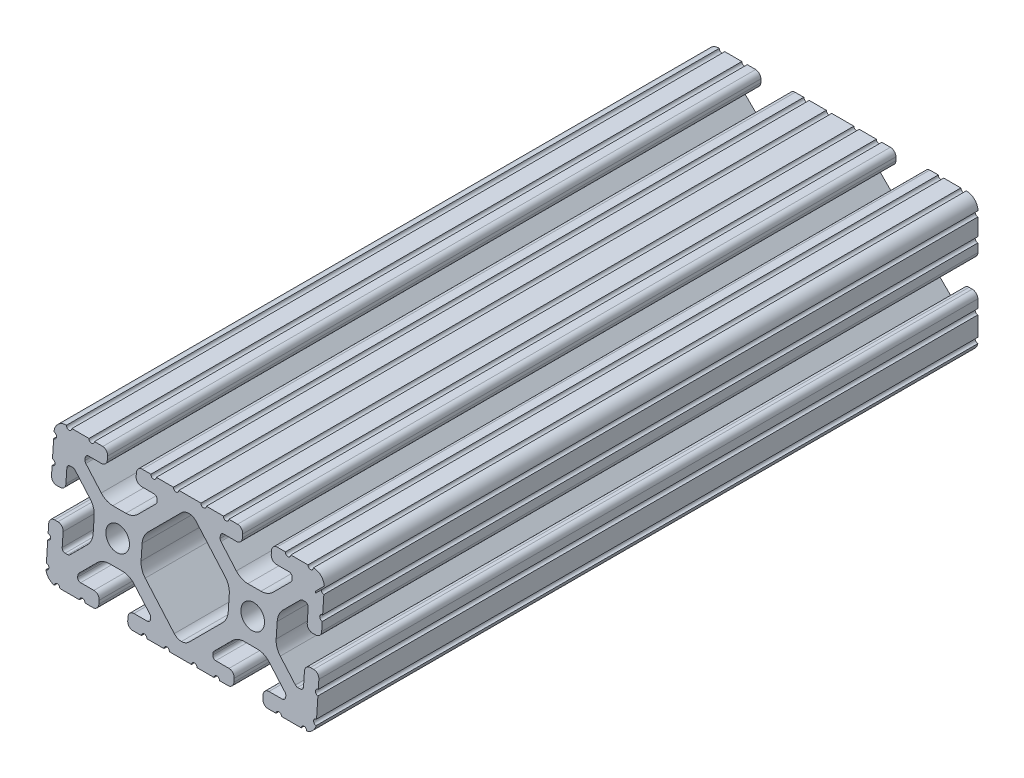
from build123d import *

# Parameters (mm, degrees)
SKETCH1_R          = 3.3274
EXTRUDE1_DEPTH     = 186.817
CUT_EXTRUDE1_DEPTH = 127


with BuildPart() as part:
    # Sketch1 → Extrude1 (new body)
    with BuildSketch(Plane.XY):
        with BuildLine():
            Line((-3.121121376, -19.05), (3.121121376, -19.05))
            ThreePointArc((3.121121376, -19.05), (3.883121376, -18.288), (4.645121376, -19.05))
            Line((4.645121376, -19.05), (8.633115796, -19.05))
            Line((8.633115796, -19.05), (9.473536067, -19.05))
            ThreePointArc((9.473536067, -19.05), (10.235536067, -18.288), (10.997536067, -19.05))
            Line((10.997536067, -19.05), (13.4112, -19.05))
            ThreePointArc((13.4112, -19.05), (14.524751759, -18.588751759), (14.986, -17.4752))
            Line((14.986, -17.4752), (14.986, -16.5608))
            ThreePointArc((14.986, -16.5608), (14.524751759, -15.447248241), (13.4112, -14.986))
            Line((13.4112, -14.986), (9.652, -14.986))
            ThreePointArc((9.652, -14.986), (9.023382072, -14.725617928), (8.763, -14.097))
            Line((8.763, -14.097), (8.763, -13.687179678))
            ThreePointArc((8.763, -13.687179678), (8.830670671, -13.346975131), (9.023380503, -13.058563318))
            Line((9.023380503, -13.058563318), (13.852498595, -8.229421131))
            ThreePointArc((13.852498595, -8.229421131), (15.393447522, -7.199787805), (17.211122763, -6.838228541))
            Line((17.211122763, -6.838228541), (20.888877237, -6.838228541))
            ThreePointArc((20.888877237, -6.838228541), (22.706552478, -7.199787805), (24.247501405, -8.229421131))
            Line((24.247501405, -8.229421131), (29.076619497, -13.058563318))
            ThreePointArc((29.076619497, -13.058563318), (29.269329329, -13.346975131), (29.337, -13.687179678))
            Line((29.337, -13.687179678), (29.337, -14.097))
            ThreePointArc((29.337, -14.097), (29.076617928, -14.725617928), (28.448, -14.986))
            Line((28.448, -14.986), (24.6888, -14.986))
            ThreePointArc((24.6888, -14.986), (23.575248241, -15.447248241), (23.114, -16.5608))
            Line((23.114, -16.5608), (23.114, -17.4752))
            ThreePointArc((23.114, -17.4752), (23.575248241, -18.588751759), (24.6888, -19.05))
            Line((24.6888, -19.05), (26.945817469, -19.05))
            ThreePointArc((26.945817469, -19.05), (27.707817469, -18.288), (28.469817469, -19.05))
            Line((28.469817469, -19.05), (29.207115796, -19.05))
            Line((29.207115796, -19.05), (34.047273398, -19.05))
            ThreePointArc((34.047273398, -19.05), (34.809273398, -18.288), (35.571273398, -19.05))
            ThreePointArc((35.571273398, -19.05), (37.207577603, -18.182738167), (38.1, -16.560019212))
            ThreePointArc((38.1, -16.560019212), (37.338, -15.798019212), (38.1, -15.036019212))
            Line((38.1, -15.036019212), (38.1, -10.287))
            Line((38.1, -10.287), (38.1, -9.549701672))
            ThreePointArc((38.1, -9.549701672), (37.338, -8.787701672), (38.1, -8.025701672))
            Line((38.1, -8.025701672), (38.1, -5.6388))
            ThreePointArc((38.1, -5.6388), (37.638751759, -4.525248241), (36.5252, -4.064))
            Line((36.5252, -4.064), (35.6108, -4.064))
            ThreePointArc((35.6108, -4.064), (34.497248241, -4.525248241), (34.036, -5.6388))
            Line((34.036, -5.6388), (34.036, -9.398))
            ThreePointArc((34.036, -9.398), (33.775617928, -10.026617928), (33.147, -10.287))
            Line((33.147, -10.287), (32.420656743, -10.287))
            ThreePointArc((32.420656743, -10.287), (32.080450147, -10.21932848), (31.792037247, -10.02661636))
            Line((31.792037247, -10.02661636), (27.197575832, -5.43213202))
            ThreePointArc((27.197575832, -5.43213202), (26.167954729, -3.891188903), (25.8064, -2.07352461))
            Line((25.8064, -2.07352461), (25.8064, 2.07352461))
            ThreePointArc((25.8064, 2.07352461), (26.167954729, 3.891188903), (27.197575832, 5.43213202))
            Line((27.197575832, 5.43213202), (31.792037247, 10.02661636))
            ThreePointArc((31.792037247, 10.02661636), (32.080450147, 10.21932848), (32.420656743, 10.287))
            Line((32.420656743, 10.287), (33.147, 10.287))
            ThreePointArc((33.147, 10.287), (33.775617928, 10.026617928), (34.036, 9.398))
            Line((34.036, 9.398), (34.036, 5.6388))
            ThreePointArc((34.036, 5.6388), (34.497248241, 4.525248241), (35.6108, 4.064))
            Line((35.6108, 4.064), (36.5252, 4.064))
            ThreePointArc((36.5252, 4.064), (37.638751759, 4.525248241), (38.1, 5.6388))
            Line((38.1, 5.6388), (38.1, 8.025701672))
            ThreePointArc((38.1, 8.025701672), (37.338, 8.787701672), (38.1, 9.549701672))
            Line((38.1, 9.549701672), (38.1, 10.287))
            Line((38.1, 10.287), (38.1, 14.375206214))
            ThreePointArc((38.1, 14.375206214), (37.338232276, 15.156019383), (38.137614868, 15.89827725))
            ThreePointArc((38.137614868, 15.89827725), (37.148019028, 18.192014021), (34.819536496, 19.096833012))
            ThreePointArc((34.819536496, 19.096833012), (34.081312886, 18.311776389), (33.296256263, 19.05))
            Line((33.296256263, 19.05), (29.207115796, 19.05))
            Line((29.207115796, 19.05), (28.469817468, 19.05))
            ThreePointArc((28.469817468, 19.05), (27.707817468, 18.288), (26.945817468, 19.05))
            Line((26.945817468, 19.05), (24.558915796, 19.05))
            ThreePointArc((24.558915796, 19.05), (23.53023695, 18.547208069), (23.114, 17.480565346))
            Line((23.114, 17.480565346), (23.114, 16.5608))
            ThreePointArc((23.114, 16.5608), (23.575248241, 15.447248241), (24.6888, 14.986))
            Line((24.6888, 14.986), (28.295243665, 14.986))
            ThreePointArc((28.295243665, 14.986), (28.923861593, 14.725617928), (29.184243665, 14.097))
            Line((29.184243665, 14.097), (29.184243665, 13.53442258))
            ThreePointArc((29.184243665, 13.53442258), (29.116572993, 13.194218033), (28.923863161, 12.90580622))
            Line((28.923863161, 12.90580622), (24.247501405, 8.229421131))
            ThreePointArc((24.247501405, 8.229421131), (22.706552478, 7.199787805), (20.888877237, 6.838228541))
            Line((20.888877237, 6.838228541), (17.211122763, 6.838228541))
            ThreePointArc((17.211122763, 6.838228541), (15.393447522, 7.199787805), (13.852498595, 8.229421131))
            Line((13.852498595, 8.229421131), (9.176136839, 12.90580622))
            ThreePointArc((9.176136839, 12.90580622), (8.983427007, 13.194218033), (8.915756335, 13.53442258))
            Line((8.915756335, 13.53442258), (8.915756335, 14.097))
            ThreePointArc((8.915756335, 14.097), (9.176138407, 14.725617928), (9.804756335, 14.986))
            Line((9.804756335, 14.986), (13.4112, 14.986))
            ThreePointArc((13.4112, 14.986), (14.524751759, 15.447248241), (14.986, 16.5608))
            Line((14.986, 16.5608), (14.986, 17.496772581))
            ThreePointArc((14.986, 17.496772581), (14.531070222, 18.595070222), (13.432772581, 19.05))
            Line((13.432772581, 19.05), (10.997536067, 19.05))
            ThreePointArc((10.997536067, 19.05), (10.235536067, 18.288), (9.473536067, 19.05))
            Line((9.473536067, 19.05), (8.633115796, 19.05))
            Line((8.633115796, 19.05), (4.645121376, 19.05))
            ThreePointArc((4.645121376, 19.05), (3.883121376, 18.288), (3.121121376, 19.05))
            Line((3.121121376, 19.05), (-3.121121376, 19.05))
            ThreePointArc((-3.121121376, 19.05), (-3.883121376, 18.288), (-4.645121376, 19.05))
            Line((-4.645121376, 19.05), (-8.633115796, 19.05))
            Line((-8.633115796, 19.05), (-9.473536067, 19.05))
            ThreePointArc((-9.473536067, 19.05), (-10.235536067, 18.288), (-10.997536067, 19.05))
            Line((-10.997536067, 19.05), (-13.432772581, 19.05))
            ThreePointArc((-13.432772581, 19.05), (-14.531070222, 18.595070222), (-14.986, 17.496772581))
            Line((-14.986, 17.496772581), (-14.986, 16.5608))
            ThreePointArc((-14.986, 16.5608), (-14.524751759, 15.447248241), (-13.4112, 14.986))
            Line((-13.4112, 14.986), (-9.804756335, 14.986))
            ThreePointArc((-9.804756335, 14.986), (-9.176138407, 14.725617928), (-8.915756335, 14.097))
            Line((-8.915756335, 14.097), (-8.915756335, 13.53442258))
            ThreePointArc((-8.915756335, 13.53442258), (-8.983427007, 13.194218033), (-9.176136839, 12.90580622))
            Line((-9.176136839, 12.90580622), (-13.852498595, 8.229421131))
            ThreePointArc((-13.852498595, 8.229421131), (-15.393447522, 7.199787805), (-17.211122763, 6.838228541))
            Line((-17.211122763, 6.838228541), (-20.888877237, 6.838228541))
            ThreePointArc((-20.888877237, 6.838228541), (-22.706552478, 7.199787805), (-24.247501405, 8.229421131))
            Line((-24.247501405, 8.229421131), (-28.923863161, 12.90580622))
            ThreePointArc((-28.923863161, 12.90580622), (-29.116572993, 13.194218033), (-29.184243665, 13.53442258))
            Line((-29.184243665, 13.53442258), (-29.184243665, 14.097))
            ThreePointArc((-29.184243665, 14.097), (-28.923861593, 14.725617928), (-28.295243665, 14.986))
            Line((-28.295243665, 14.986), (-24.6888, 14.986))
            ThreePointArc((-24.6888, 14.986), (-23.575248241, 15.447248241), (-23.114, 16.5608))
            Line((-23.114, 16.5608), (-23.114, 17.480565346))
            ThreePointArc((-23.114, 17.480565346), (-23.53023695, 18.547208069), (-24.558915796, 19.05))
            Line((-24.558915796, 19.05), (-26.945817468, 19.05))
            ThreePointArc((-26.945817468, 19.05), (-27.707817468, 18.288), (-28.469817468, 19.05))
            Line((-28.469817468, 19.05), (-29.207115796, 19.05))
            Line((-29.207115796, 19.05), (-33.296256263, 19.05))
            ThreePointArc((-33.296256263, 19.05), (-34.081312886, 18.311776389), (-34.819536496, 19.096833012))
            ThreePointArc((-34.819536496, 19.096833012), (-37.148019028, 18.192014021), (-38.137614868, 15.89827725))
            ThreePointArc((-38.137614868, 15.89827725), (-37.338232276, 15.156019383), (-38.1, 14.375206214))
            Line((-38.1, 14.375206214), (-38.1, 10.287))
            Line((-38.1, 10.287), (-38.1, 9.549701672))
            ThreePointArc((-38.1, 9.549701672), (-37.338, 8.787701672), (-38.1, 8.025701672))
            Line((-38.1, 8.025701672), (-38.1, 5.6388))
            ThreePointArc((-38.1, 5.6388), (-37.638751759, 4.525248241), (-36.5252, 4.064))
            Line((-36.5252, 4.064), (-35.6108, 4.064))
            ThreePointArc((-35.6108, 4.064), (-34.497248241, 4.525248241), (-34.036, 5.6388))
            Line((-34.036, 5.6388), (-34.036, 9.398))
            ThreePointArc((-34.036, 9.398), (-33.775617928, 10.026617928), (-33.147, 10.287))
            Line((-33.147, 10.287), (-32.420656743, 10.287))
            ThreePointArc((-32.420656743, 10.287), (-32.080450147, 10.21932848), (-31.792037247, 10.02661636))
            Line((-31.792037247, 10.02661636), (-27.197575832, 5.43213202))
            ThreePointArc((-27.197575832, 5.43213202), (-26.167954729, 3.891188903), (-25.8064, 2.07352461))
            Line((-25.8064, 2.07352461), (-25.8064, -2.07352461))
            ThreePointArc((-25.8064, -2.07352461), (-26.167954729, -3.891188903), (-27.197575832, -5.43213202))
            Line((-27.197575832, -5.43213202), (-31.792037247, -10.02661636))
            ThreePointArc((-31.792037247, -10.02661636), (-32.080450147, -10.21932848), (-32.420656743, -10.287))
            Line((-32.420656743, -10.287), (-33.147, -10.287))
            ThreePointArc((-33.147, -10.287), (-33.775617928, -10.026617928), (-34.036, -9.398))
            Line((-34.036, -9.398), (-34.036, -5.6388))
            ThreePointArc((-34.036, -5.6388), (-34.497248241, -4.525248241), (-35.6108, -4.064))
            Line((-35.6108, -4.064), (-36.5252, -4.064))
            ThreePointArc((-36.5252, -4.064), (-37.638751759, -4.525248241), (-38.1, -5.6388))
            Line((-38.1, -5.6388), (-38.1, -8.025701672))
            ThreePointArc((-38.1, -8.025701672), (-37.338, -8.787701672), (-38.1, -9.549701672))
            Line((-38.1, -9.549701672), (-38.1, -10.287))
            Line((-38.1, -10.287), (-38.1, -15.036019212))
            ThreePointArc((-38.1, -15.036019212), (-37.338, -15.798019212), (-38.1, -16.560019212))
            ThreePointArc((-38.1, -16.560019212), (-37.20882252, -18.184002456), (-35.571273398, -19.05))
            ThreePointArc((-35.571273398, -19.05), (-34.809273398, -18.288), (-34.047273398, -19.05))
            Line((-34.047273398, -19.05), (-29.207115796, -19.05))
            Line((-29.207115796, -19.05), (-28.469817469, -19.05))
            ThreePointArc((-28.469817469, -19.05), (-27.707817469, -18.288), (-26.945817469, -19.05))
            Line((-26.945817469, -19.05), (-24.6888, -19.05))
            ThreePointArc((-24.6888, -19.05), (-23.575248241, -18.588751759), (-23.114, -17.4752))
            Line((-23.114, -17.4752), (-23.114, -16.5608))
            ThreePointArc((-23.114, -16.5608), (-23.575248241, -15.447248241), (-24.6888, -14.986))
            Line((-24.6888, -14.986), (-28.448, -14.986))
            ThreePointArc((-28.448, -14.986), (-29.076617928, -14.725617928), (-29.337, -14.097))
            Line((-29.337, -14.097), (-29.337, -13.687179678))
            ThreePointArc((-29.337, -13.687179678), (-29.269329329, -13.346975131), (-29.076619497, -13.058563318))
            Line((-29.076619497, -13.058563318), (-24.247501405, -8.229421131))
            ThreePointArc((-24.247501405, -8.229421131), (-22.706552478, -7.199787805), (-20.888877237, -6.838228541))
            Line((-20.888877237, -6.838228541), (-17.211122763, -6.838228541))
            ThreePointArc((-17.211122763, -6.838228541), (-15.393447522, -7.199787805), (-13.852498595, -8.229421131))
            Line((-13.852498595, -8.229421131), (-9.023380503, -13.058563318))
            ThreePointArc((-9.023380503, -13.058563318), (-8.830670671, -13.346975131), (-8.763, -13.687179678))
            Line((-8.763, -13.687179678), (-8.763, -14.097))
            ThreePointArc((-8.763, -14.097), (-9.023382072, -14.725617928), (-9.652, -14.986))
            Line((-9.652, -14.986), (-13.4112, -14.986))
            ThreePointArc((-13.4112, -14.986), (-14.524751759, -15.447248241), (-14.986, -16.5608))
            Line((-14.986, -16.5608), (-14.986, -17.4752))
            ThreePointArc((-14.986, -17.4752), (-14.524751759, -18.588751759), (-13.4112, -19.05))
            Line((-13.4112, -19.05), (-10.997536067, -19.05))
            ThreePointArc((-10.997536067, -19.05), (-10.235536067, -18.288), (-9.473536067, -19.05))
            Line((-9.473536067, -19.05), (-8.633115796, -19.05))
            Line((-8.633115796, -19.05), (-4.645121376, -19.05))
            ThreePointArc((-4.645121376, -19.05), (-3.883121376, -18.288), (-3.121121376, -19.05))
        make_face()
        with Locations((19.05, 0)):
            Circle(SKETCH1_R, mode=Mode.SUBTRACT)
        with Locations((-19.05, 0)):
            Circle(SKETCH1_R, mode=Mode.SUBTRACT)
        with BuildLine():
            Line((2.077035361, 14.257564863), (10.902424168, 5.43213202))
            ThreePointArc((10.902424168, 5.43213202), (11.932045271, 3.891188903), (12.2936, 2.07352461))
            Line((12.2936, 2.07352461), (12.2936, -2.07352461))
            ThreePointArc((12.2936, -2.07352461), (11.932045271, -3.891188903), (10.902424168, -5.43213202))
            Line((10.902424168, -5.43213202), (2.077035361, -14.257564863))
            ThreePointArc((2.077035361, -14.257564863), (1.124045601, -14.892973012), (0, -15.113096807))
            ThreePointArc((0, -15.113096807), (-1.124045601, -14.892973012), (-2.077035361, -14.257564863))
            Line((-2.077035361, -14.257564863), (-10.902424168, -5.43213202))
            ThreePointArc((-10.902424168, -5.43213202), (-11.932045271, -3.891188903), (-12.2936, -2.07352461))
            Line((-12.2936, -2.07352461), (-12.2936, 2.07352461))
            ThreePointArc((-12.2936, 2.07352461), (-11.932045271, 3.891188903), (-10.902424168, 5.43213202))
            Line((-10.902424168, 5.43213202), (-2.077035361, 14.257564863))
            ThreePointArc((-2.077035361, 14.257564863), (-1.124045601, 14.892973012), (0, 15.113096807))
            ThreePointArc((0, 15.113096807), (1.124045601, 14.892973012), (2.077035361, 14.257564863))
        make_face(mode=Mode.SUBTRACT)
    extrude(amount=-EXTRUDE1_DEPTH)

    # Sketch2 → Cut-Extrude1 (cut)
    with BuildSketch(Plane(origin=(38.1, 0, 0), x_dir=(0, 0, -1), z_dir=(1, 0, 0))):
        Polygon((0, -19.05), (0, 19.097909589), (2.6675617, 19.097909589), align=None)
    extrude(amount=-CUT_EXTRUDE1_DEPTH, mode=Mode.SUBTRACT)


solid = part.part
